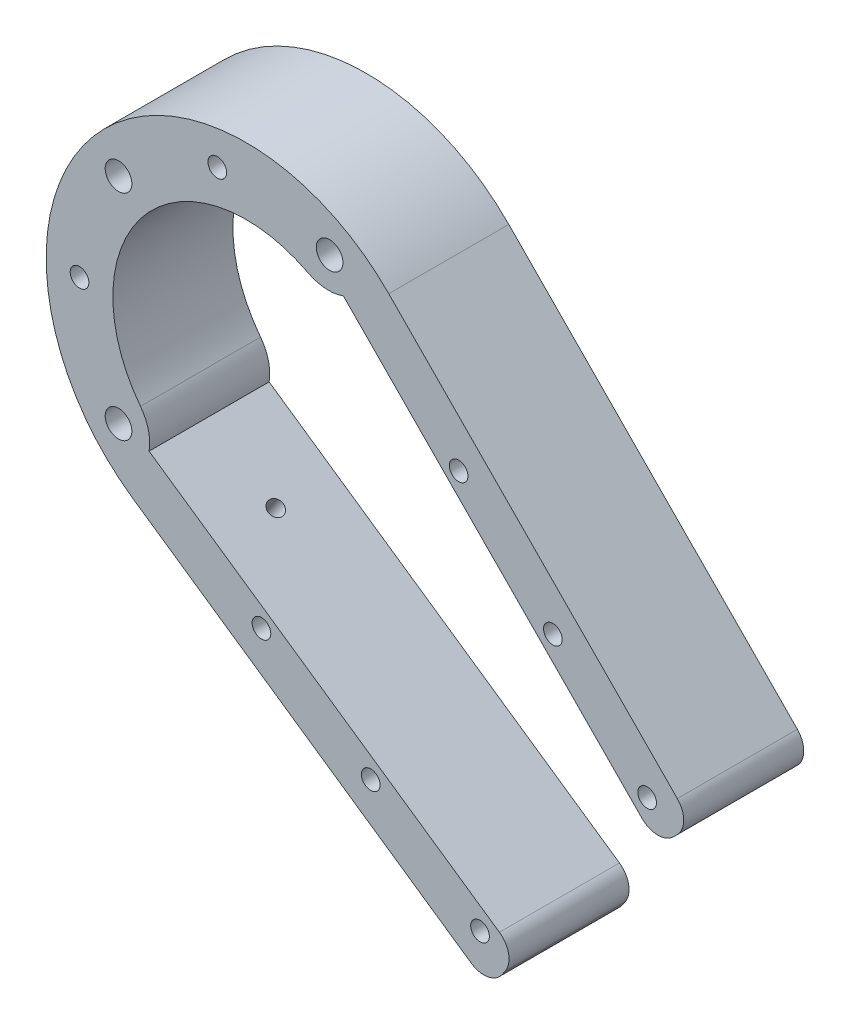
from build123d import *

# Parameters (mm, degrees)
SKETCH1_R           = 1.6
BOSS_EXTRUDE1_DEPTH = 27
CUT_EXTRUDE1_REACH  = 138.335
SKETCH2_R           = 2.1
CUT_EXTRUDE2_REACH  = 155.174
SKETCH3_R           = 1.7
SKETCH3_3_R         = 3
SKETCH3_3_R_2       = 1.7
CUT_EXTRUDE3_DEPTH  = 3
SKETCH4_R           = 3
CUT_EXTRUDE4_DEPTH  = 8
BOSS_EXTRUDE2_START = -27
BOSS_EXTRUDE2_DEPTH = 27
FILLET1_R           = 10


with BuildPart() as part:
    # Sketch1 → Boss-Extrude1 (new body)
    with BuildSketch(Plane.XY.offset(10)):
        with BuildLine():
            Line((-25.534872354, -37.053613776), (50.619597549, -89.534180987))
            ThreePointArc((50.619597549, -89.534180987), (54.361803385, -90.334528675), (57.573873786, -88.254320829))
            Line((57.573873786, -88.254320829), (58.227827632, -87.305369414))
            ThreePointArc((58.227827632, -87.305369414), (59.02817532, -83.563163578), (56.947967474, -80.351093178))
            Line((56.947967474, -80.351093178), (-21.854778729, -26.045511066))
            ThreePointArc((-21.854778729, -26.045511066), (-26.045511066, 21.854778729), (21.854778729, 26.045511066))
            Line((21.854778729, 26.045511066), (89.019290298, -42.129978983))
            ThreePointArc((89.019290298, -42.129978983), (92.543786433, -43.620813626), (96.090160837, -42.182797794))
            Line((96.090160837, -42.182797794), (96.911137653, -41.373995292))
            ThreePointArc((96.911137653, -41.373995292), (98.401972296, -37.849499157), (96.963956464, -34.303124754))
            Line((96.963956464, -34.303124754), (32.056602073, 31.581232775))
            ThreePointArc((32.056602073, 31.581232775), (-34.47199994, 28.925442436), (-25.534872354, -37.053613776))
        make_face()
        with Locations((90.17973297, -37.494440018)):
            Circle(SKETCH1_R, mode=Mode.SUBTRACT)
        with Locations((68.973861607, -16.273907044)):
            Circle(SKETCH1_R, mode=Mode.SUBTRACT)
        with Locations((47.767990244, 4.946625931)):
            Circle(SKETCH1_R, mode=Mode.SUBTRACT)
        with Locations((18.75, 32.475952642)):
            Circle(SKETCH1_R, mode=Mode.SUBTRACT)
        with Locations((-6.511806663, 36.930290738)):
            Circle(SKETCH1_R, mode=Mode.SUBTRACT)
        with Locations((-28.726666617, 24.104535363)):
            Circle(SKETCH1_R, mode=Mode.SUBTRACT)
        with Locations((-37.5, 0)):
            Circle(SKETCH1_R, mode=Mode.SUBTRACT)
        with Locations((-28.726666617, -24.104535363)):
            Circle(SKETCH1_R, mode=Mode.SUBTRACT)
        with Locations((3.423348889, -47.901259716)):
            Circle(SKETCH1_R, mode=Mode.SUBTRACT)
        with Locations((28.003855203, -65.100059364)):
            Circle(SKETCH1_R, mode=Mode.SUBTRACT)
        with Locations((52.584361518, -82.298859012)):
            Circle(SKETCH1_R, mode=Mode.SUBTRACT)
    extrude(amount=BOSS_EXTRUDE1_DEPTH)

    # Sketch2 → Cut-Extrude1 (cut, up to next)
    with BuildSketch(Plane.XY.offset(37), mode=Mode.PRIVATE) as cut_extrude1_sk1:
        with Locations((52.584361518, -82.298859012)):
            Circle(SKETCH2_R)
    cut_extrude1_tool1 = extrude(cut_extrude1_sk1.sketch, amount=-CUT_EXTRUDE1_REACH, mode=Mode.PRIVATE) & part.part
    # Sketch2 → Cut-Extrude1 (cut, up to next)
    with BuildSketch(Plane.XY.offset(37), mode=Mode.PRIVATE) as cut_extrude1_sk2:
        with Locations((28.003855203, -65.100059364)):
            Circle(SKETCH2_R)
    cut_extrude1_tool2 = extrude(cut_extrude1_sk2.sketch, amount=-CUT_EXTRUDE1_REACH, mode=Mode.PRIVATE) & part.part
    # Sketch2 → Cut-Extrude1 (cut, up to next)
    with BuildSketch(Plane.XY.offset(37), mode=Mode.PRIVATE) as cut_extrude1_sk3:
        with Locations((3.423348889, -47.901259716)):
            Circle(SKETCH2_R)
    cut_extrude1_tool3 = extrude(cut_extrude1_sk3.sketch, amount=-CUT_EXTRUDE1_REACH, mode=Mode.PRIVATE) & part.part
    # Sketch2 → Cut-Extrude1 (cut, up to next)
    with BuildSketch(Plane.XY.offset(37), mode=Mode.PRIVATE) as cut_extrude1_sk4:
        with Locations((-28.726666617, -24.104535363)):
            Circle(SKETCH2_R)
    cut_extrude1_tool4 = extrude(cut_extrude1_sk4.sketch, amount=-CUT_EXTRUDE1_REACH, mode=Mode.PRIVATE) & part.part
    # Sketch2 → Cut-Extrude1 (cut, up to next)
    with BuildSketch(Plane.XY.offset(37), mode=Mode.PRIVATE) as cut_extrude1_sk5:
        with Locations((-37.5, 0)):
            Circle(SKETCH2_R)
    cut_extrude1_tool5 = extrude(cut_extrude1_sk5.sketch, amount=-CUT_EXTRUDE1_REACH, mode=Mode.PRIVATE) & part.part
    # Sketch2 → Cut-Extrude1 (cut, up to next)
    with BuildSketch(Plane.XY.offset(37), mode=Mode.PRIVATE) as cut_extrude1_sk6:
        with Locations((-28.726666617, 24.104535363)):
            Circle(SKETCH2_R)
    cut_extrude1_tool6 = extrude(cut_extrude1_sk6.sketch, amount=-CUT_EXTRUDE1_REACH, mode=Mode.PRIVATE) & part.part
    # Sketch2 → Cut-Extrude1 (cut, up to next)
    with BuildSketch(Plane.XY.offset(37), mode=Mode.PRIVATE) as cut_extrude1_sk7:
        with Locations((-6.511806663, 36.930290738)):
            Circle(SKETCH2_R)
    cut_extrude1_tool7 = extrude(cut_extrude1_sk7.sketch, amount=-CUT_EXTRUDE1_REACH, mode=Mode.PRIVATE) & part.part
    # Sketch2 → Cut-Extrude1 (cut, up to next)
    with BuildSketch(Plane.XY.offset(37), mode=Mode.PRIVATE) as cut_extrude1_sk8:
        with Locations((18.75, 32.475952642)):
            Circle(SKETCH2_R)
    cut_extrude1_tool8 = extrude(cut_extrude1_sk8.sketch, amount=-CUT_EXTRUDE1_REACH, mode=Mode.PRIVATE) & part.part
    # Sketch2 → Cut-Extrude1 (cut, up to next)
    with BuildSketch(Plane.XY.offset(37), mode=Mode.PRIVATE) as cut_extrude1_sk9:
        with Locations((47.767990244, 4.946625931)):
            Circle(SKETCH2_R)
    cut_extrude1_tool9 = extrude(cut_extrude1_sk9.sketch, amount=-CUT_EXTRUDE1_REACH, mode=Mode.PRIVATE) & part.part
    # Sketch2 → Cut-Extrude1 (cut, up to next)
    with BuildSketch(Plane.XY.offset(37), mode=Mode.PRIVATE) as cut_extrude1_sk10:
        with Locations((68.973861607, -16.273907044)):
            Circle(SKETCH2_R)
    cut_extrude1_tool10 = extrude(cut_extrude1_sk10.sketch, amount=-CUT_EXTRUDE1_REACH, mode=Mode.PRIVATE) & part.part
    # Sketch2 → Cut-Extrude1 (cut, up to next)
    with BuildSketch(Plane.XY.offset(37), mode=Mode.PRIVATE) as cut_extrude1_sk11:
        with Locations((90.17973297, -37.494440018)):
            Circle(SKETCH2_R)
    cut_extrude1_tool11 = extrude(cut_extrude1_sk11.sketch, amount=-CUT_EXTRUDE1_REACH, mode=Mode.PRIVATE) & part.part
    add(cut_extrude1_tool1.solids().sort_by_distance((52.584362, -82.298859, 37))[0], mode=Mode.SUBTRACT)
    add(cut_extrude1_tool2.solids().sort_by_distance((28.003855, -65.100059, 37))[0], mode=Mode.SUBTRACT)
    add(cut_extrude1_tool3.solids().sort_by_distance((3.423349, -47.90126, 37))[0], mode=Mode.SUBTRACT)
    add(cut_extrude1_tool4.solids().sort_by_distance((-28.726667, -24.104535, 37))[0], mode=Mode.SUBTRACT)
    add(cut_extrude1_tool5.solids().sort_by_distance((-37.5, 0, 37))[0], mode=Mode.SUBTRACT)
    add(cut_extrude1_tool6.solids().sort_by_distance((-28.726667, 24.104535, 37))[0], mode=Mode.SUBTRACT)
    add(cut_extrude1_tool7.solids().sort_by_distance((-6.511807, 36.930291, 37))[0], mode=Mode.SUBTRACT)
    add(cut_extrude1_tool8.solids().sort_by_distance((18.75, 32.475953, 37))[0], mode=Mode.SUBTRACT)
    add(cut_extrude1_tool9.solids().sort_by_distance((47.76799, 4.946626, 37))[0], mode=Mode.SUBTRACT)
    add(cut_extrude1_tool10.solids().sort_by_distance((68.973862, -16.273907, 37))[0], mode=Mode.SUBTRACT)
    add(cut_extrude1_tool11.solids().sort_by_distance((90.179733, -37.49444, 37))[0], mode=Mode.SUBTRACT)

    # Sketch3 → Cut-Extrude2 (cut, up to next)
    with BuildSketch(Plane(origin=(-25.534872354, -37.053613776, 0), x_dir=(0.823413639467006, -0.567441607867893, 0), z_dir=(-0.5674416078678929, -0.8234136394670059, 0)), mode=Mode.PRIVATE) as cut_extrude2_sk1:
        with Locations((15, 23.5)):
            Circle(SKETCH3_R)
    cut_extrude2_tool1 = extrude(cut_extrude2_sk1.sketch, amount=-CUT_EXTRUDE2_REACH, mode=Mode.PRIVATE) & part.part
    add(cut_extrude2_tool1.solids().sort_by_distance((-13.183668, -45.565238, 23.5))[0], mode=Mode.SUBTRACT)

    # Sketch3<3> → Cut-Extrude3 (cut)
    with BuildSketch(Plane(origin=(-25.534872354, -37.053613776, 0), x_dir=(0.823413639467006, -0.567441607867893, 0), z_dir=(-0.5674416078678929, -0.8234136394670059, 0))):
        with Locations((15, 23.5)):
            Circle(SKETCH3_3_R)
        with Locations((15, 23.5)):
            Circle(SKETCH3_3_R_2, mode=Mode.SUBTRACT)
    extrude(amount=-CUT_EXTRUDE3_DEPTH, mode=Mode.SUBTRACT)

    # Sketch4 → Cut-Extrude4 (cut)
    with BuildSketch(Plane.XY.offset(37)):
        with Locations((18.75, 32.475952642)):
            Circle(SKETCH4_R)
        with Locations((-28.726666617, 24.104535363)):
            Circle(SKETCH4_R)
        with Locations((-28.726666617, -24.104535363)):
            Circle(SKETCH4_R)
    cut_extrude4 = extrude(amount=-CUT_EXTRUDE4_DEPTH, mode=Mode.SUBTRACT)

    # Sketch5 → Boss-Extrude2 (add)
    with BuildSketch(Plane.XY.offset(37).offset(BOSS_EXTRUDE2_START)):
        with BuildLine():
            Line((-19.283628291, -22.981333294), (-21.854778729, -26.045511066))
            ThreePointArc((-21.854778729, -26.045511066), (-26.045511066, 21.854778729), (21.854778729, 26.045511066))
            Line((21.854778729, 26.045511066), (19.283628291, 22.981333294))
            ThreePointArc((19.283628291, 22.981333294), (-22.981333294, 19.283628291), (-19.283628291, -22.981333294))
        make_face()
    extrude(amount=BOSS_EXTRUDE2_DEPTH)

    # Fillet1
    # the kernel refuses this fillet: 10 mm, written as the material it takes off along each edge
    with BuildSketch(Plane(origin=(-19.283628291, -22.981333294, -6.269784336), x_dir=(-0.6427876096873701, -0.7660444431182809, 0), z_dir=(0, 0, 1))) as fillet1_piece_1:
        with BuildLine():
            CenterArc((9.058823529, -8.626024838), FILLET1_R, 120.389942449, 47.156356956)
            Line((-0.705882353, -6.469518628), (-0.901176471, -6.426388504))
            ThreePointArc((-0.901176471, -6.426388504), (-0.375812744, -3.232263822), (-0.2, 0))
            Line((-0.2, 0), (0, 0.2))
            ThreePointArc((0, 0.2), (2, 0.2), (3.898823529, 0.172520497))
            Line((3.898823529, 0.172520497), (4, 0))
        make_face()
    extrude(amount=59.539568673, mode=Mode.SUBTRACT)
    with BuildSketch(Plane(origin=(19.283628291, 22.981333294, -6.269784336), x_dir=(0.6427876096857099, 0.7660444431196739, 0), z_dir=(0, 0, 1))) as fillet1_piece_2:
        with BuildLine():
            CenterArc((9.058823529, 8.626024838), FILLET1_R, 192.453700594, 47.156356956)
            Line((-0.705882353, 6.469518628), (-0.901176471, 6.426388504))
            ThreePointArc((-0.901176471, 6.426388504), (-0.375812744, 3.232263822), (-0.2, 0))
            Line((-0.2, 0), (0, -0.2))
            ThreePointArc((0, -0.2), (2, -0.2), (3.898823529, -0.172520497))
            Line((3.898823529, -0.172520497), (4, 0))
        make_face()
    extrude(amount=59.539568673, mode=Mode.SUBTRACT)

    # Mirror1: Cut-Extrude4 across plane
    add(cut_extrude4.mirror(Plane.XY.offset(23.5)), mode=Mode.SUBTRACT)


solid = part.part
